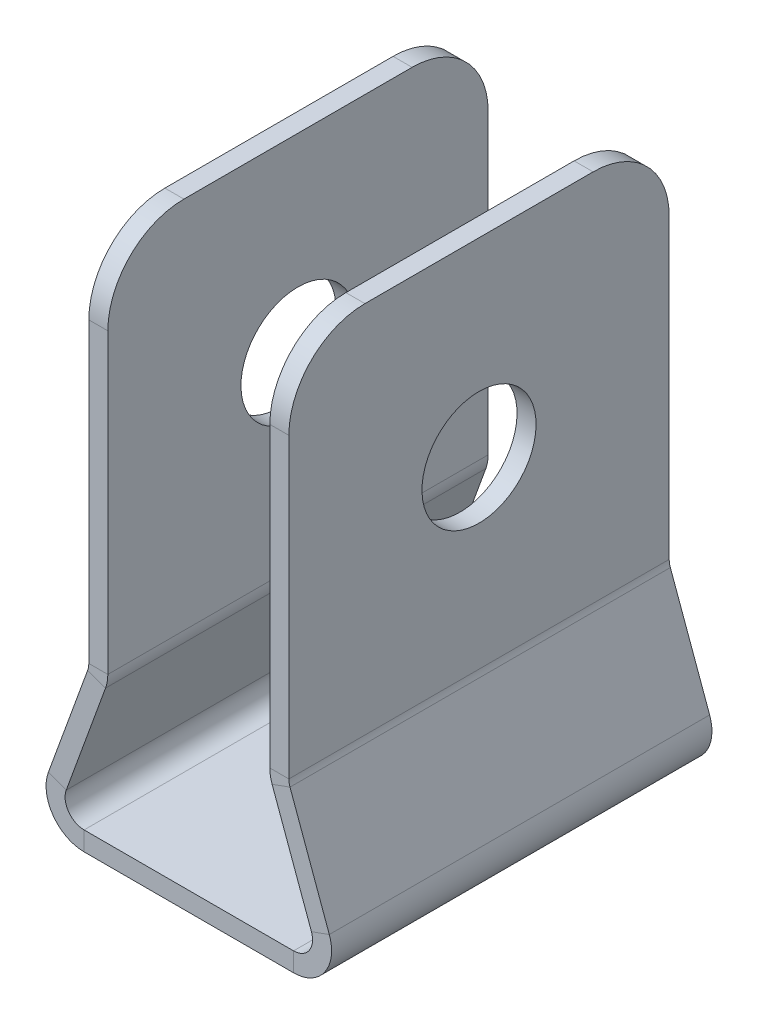
from build123d import *

# Parameters (mm, degrees)
SKETCH_1_W               = 8
SKETCH_1_H               = 10
SKETCH_1_R               = 1.5
EXTRUDE_1_DEPTH          = 0.5
SM_START                 = -5
SM_EDGE_FLANGE_1_DEPTH   = 10
SM_EDGE_FLANGE_1_2_DEPTH = 10
SM_EDGE_FLANGE_2_DEPTH   = 10
SM_EDGE_FLANGE_2_2_DEPTH = 10
FILLET_1_R               = 2
SKETCH_18_R              = 1.5
CUT_EXTRUDE_1_DEPTH      = 10


# Read off the part's stored shape, not the designer's step: Ребро-кромка1, Ребро-кромка2
with BuildPart() as part:
    # Sketch 1 → Бобышка-Вытянуть1 (new body)
    with BuildSketch(Plane(origin=(0, 0, 0), x_dir=(1, 0, 0), z_dir=(0, 1, 0))):
        Rectangle(SKETCH_1_W, SKETCH_1_H)
        with Locations(Location((0, 0, 0), (0, 0, 270))):
            Circle(SKETCH_1_R, mode=Mode.SUBTRACT)
    extrude(amount=EXTRUDE_1_DEPTH)

    # Ребро-кромка1 outline → Ребро-кромка1 (cut)
    with BuildSketch(Plane.XY.offset(SM_START)):
        with BuildLine():
            ThreePointArc((-2.75383711, 0), (-3.25383711, 0.133974596), (-3.619862514, 0.5))
            Line((-3.619862514, 0.5), (-4, 0.5))
            Line((-4, 0.5), (-4, 0))
            Line((-4, 0), (-2.75383711, 0))
        make_face()
        with BuildLine():
            ThreePointArc((3.619862514, 0.5), (3.25383711, 0.133974596), (2.75383711, 0))
            Line((2.75383711, 0), (4, 0))
            Line((4, 0), (4, 0.5))
            Line((4, 0.5), (3.619862514, 0.5))
        make_face()
    extrude(amount=SM_EDGE_FLANGE_1_DEPTH, mode=Mode.SUBTRACT)

    # Sm Edge Flange 1 2 outline → Sm Edge Flange 1 2 (add)
    with BuildSketch(Plane.XY.offset(SM_START)):
        with BuildLine():
            Line((-2.129864257, 5.638155725), (-3.693529731, 1.342020143))
            ThreePointArc((-3.693529731, 1.342020143), (-3.750031808, 0.912844257), (-3.619862514, 0.5))
            Line((-3.619862514, 0.5), (-2.75383711, 0.5))
            ThreePointArc((-2.75383711, 0.5), (-3.163413133, 0.713211782), (-3.223683421, 1.171010072))
            Line((-3.223683421, 1.171010072), (-1.660017947, 5.467145653))
            Line((-1.660017947, 5.467145653), (-2.129864257, 5.638155725))
        make_face()
        with BuildLine():
            ThreePointArc((3.223683421, 1.171010072), (3.163413133, 0.713211782), (2.75383711, 0.5))
            Line((2.75383711, 0.5), (3.619862514, 0.5))
            ThreePointArc((3.619862514, 0.5), (3.750031808, 0.912844257), (3.693529731, 1.342020143))
            Line((3.693529731, 1.342020143), (2.129864257, 5.638155725))
            Line((2.129864257, 5.638155725), (1.660017947, 5.467145653))
            Line((1.660017947, 5.467145653), (3.223683421, 1.171010072))
        make_face()
    extrude(amount=SM_EDGE_FLANGE_1_2_DEPTH)

    # Ребро-кромка2 outline → Ребро-кромка2 (cut)
    with BuildSketch(Plane.XY.offset(SM_START)):
        with BuildLine():
            Line((-2.129864257, 5.638155725), (-2.129864257, 4.352580505))
            ThreePointArc((-2.129864257, 4.352580505), (-2.145056504, 4.178932328), (-2.190171636, 4.010560362))
            Line((-2.190171636, 4.010560362), (-1.660017947, 5.467145653))
            Line((-1.660017947, 5.467145653), (-2.129864257, 5.638155725))
        make_face()
        with BuildLine():
            Line((2.129864257, 4.352580505), (2.129864257, 5.638155725))
            Line((2.129864257, 5.638155725), (1.660017947, 5.467145653))
            Line((1.660017947, 5.467145653), (2.190171636, 4.010560362))
            ThreePointArc((2.190171636, 4.010560362), (2.145056504, 4.178932328), (2.129864257, 4.352580505))
        make_face()
    extrude(amount=SM_EDGE_FLANGE_2_DEPTH, mode=Mode.SUBTRACT)

    # Sm Edge Flange 2 2 outline → Sm Edge Flange 2 2 (add)
    with BuildSketch(Plane.XY.offset(SM_START)):
        with BuildLine():
            Line((-2.660017947, 4.181570434), (-2.129864257, 5.638155725))
            Line((-2.129864257, 5.638155725), (-2.129864257, 14.176253525))
            Line((-2.129864257, 14.176253525), (-2.629864257, 14.176253525))
            Line((-2.629864257, 14.176253525), (-2.629864257, 4.352580505))
            ThreePointArc((-2.629864257, 4.352580505), (-2.637460381, 4.265756417), (-2.660017947, 4.181570434))
        make_face()
        with BuildLine():
            Line((2.629864257, 4.352580505), (2.629864257, 14.176253525))
            Line((2.629864257, 14.176253525), (2.129864257, 14.176253525))
            Line((2.129864257, 14.176253525), (2.129864257, 5.638155725))
            Line((2.129864257, 5.638155725), (2.660017947, 4.181570434))
            ThreePointArc((2.660017947, 4.181570434), (2.637460381, 4.265756417), (2.629864257, 4.352580505))
        make_face()
    extrude(amount=SM_EDGE_FLANGE_2_2_DEPTH)

    # Скругление1
    fillet_1_edges = [part.edges().sort_by_distance(p)[0] for p in [
        (-2.379864257, 14.176253525, 5),
        (-2.379864257, 14.176253525, -5),
        (2.379864257, 14.176253525, -5),
        (2.379864257, 14.176253525, 5),
    ]]
    fillet(fillet_1_edges, radius=FILLET_1_R)

    # Эскиз18 → Вырез-Вытянуть1 (cut)
    with BuildSketch(Plane(origin=(2.629864257, 0, 0), x_dir=(0, 0, -1), z_dir=(1, 0, 0))):
        with Locations(Location((0, 9.176253525, 0), (0, 0, 90))):
            Circle(SKETCH_18_R)
    extrude(amount=-CUT_EXTRUDE_1_DEPTH, mode=Mode.SUBTRACT)


solid = part.part
